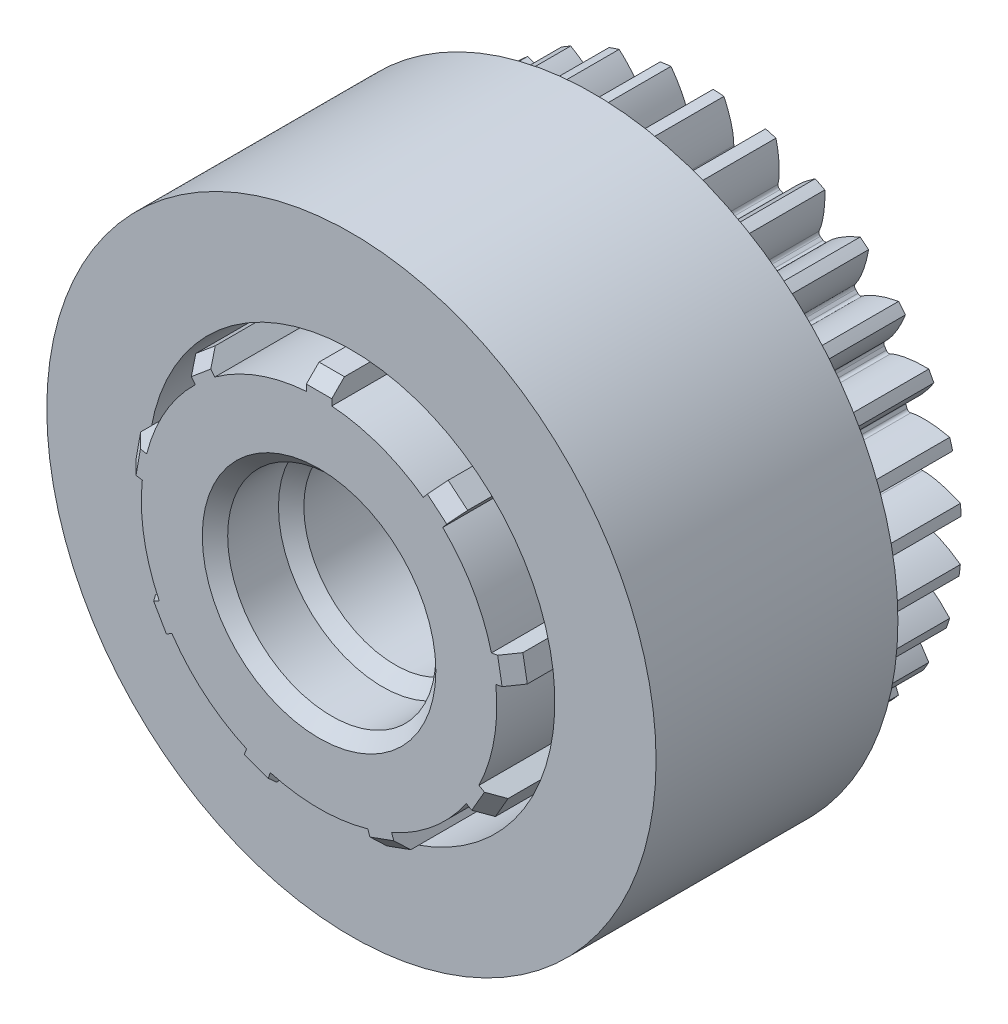
from build123d import *

# Parameters (mm, degrees)
SKETCH2_R                = 20.625
BOSS_EXTRUDE1_DEPTH      = 8
CUT_EXTRUDE1_DEPTH       = 8
FILLET1_R                = 0.254
CIRPATTERN3_COUNT        = 31
FILLET1_OF_CIRPATTERN3_R = 0.254
SKETCH3_R                = 14
BOSS_EXTRUDE2_DEPTH      = 22
SKETCH5_R                = 20.625
SKETCH5_R_2              = 8.2
BOSS_EXTRUDE3_DEPTH      = 0.4
CHAMFER1_SIZE            = 1
SKETCH6_R                = 24
SKETCH6_R_2              = 16.024540552
BOSS_EXTRUDE4_DEPTH      = 19.05


# Read off the part's stored shape, not the designer's step: Cut-Extrude1
with BuildPart() as part:
    # Sketch2 → Boss-Extrude1 (new body)
    with BuildSketch(Plane.XY):
        Circle(SKETCH2_R)
    extrude(amount=BOSS_EXTRUDE1_DEPTH)

    # Cut-Extrude1 outline → Cut-Extrude1 (cut)
    with BuildSketch(Plane.XY):
        with BuildLine():
            add(Edge.make_bspline(
                [(17.559713374, 0), (17.572698233, 0), (17.609107204, 0.000850571), (17.677859211, 0.005816678), (17.78968329, 0.018678066), (17.931450237, 0.042034495), (18.113517418, 0.080180555), (18.32617441, 0.13528476), (18.557559261, 0.206406213), (18.806378806, 0.295060405), (19.051715478, 0.393383127), (19.293462298, 0.500544622), (19.531396185, 0.615418835), (19.815898477, 0.764023045), (20.110883358, 0.932046436), (20.343724673, 1.076798935), (20.517173394, 1.190900484), (20.587786759, 1.238410823)],
                knots=[0, 0, 0, 0, 0, 0.005376748, 0.015083688, 0.02853182, 0.046610139, 0.064854849, 0.092110525, 0.119476175, 0.146842495, 0.174208853, 0.201574955, 0.228941013, 0.256307345, 0.307035032, 0.342302919, 0.342302919, 0.342302919, 0.342302919, 0.342302919], degree=4))
            Line((17.559713374, 0), (17.544673734, -0.726606726))
            add(Edge.make_bspline(
                [(20.518909181, -2.089256094), (20.450322235, -2.038864523), (20.281743499, -1.917683532), (20.055091351, -1.763420227), (19.767311792, -1.58333451), (19.489202294, -1.423085103), (19.256225596, -1.298463766), (19.019120084, -1.181390766), (18.778062055, -1.073000423), (18.533124059, -0.974126211), (18.304880333, -0.893491155), (18.094685647, -0.829634571), (17.914352856, -0.78398739), (17.773673801, -0.754784764), (17.662477692, -0.737307201), (17.593990063, -0.729500446), (17.557647471, -0.727144029), (17.544673734, -0.726606726)],
                knots=[0.566787997, 0.566787997, 0.566787997, 0.566787997, 0.566787997, 0.602055884, 0.652783571, 0.680149903, 0.707515961, 0.734882063, 0.762248421, 0.789614741, 0.816980391, 0.844236067, 0.862480777, 0.880559096, 0.894007228, 0.903714168, 0.909090916, 0.909090916, 0.909090916, 0.909090916, 0.909090916], degree=4))
            ThreePointArc((20.518909181, -2.089256094), (20.620583274, -0.426814303), (20.587786759, 1.238410823))
        make_face()
    cut_extrude1 = extrude(amount=CUT_EXTRUDE1_DEPTH, mode=Mode.SUBTRACT)

    # Fillet1
    fillet1_edges = [part.edges().sort_by_distance(p)[0] for p in [
        (17.544673734, -0.726606726, 4),
        (17.559713374, 0, 4),
    ]]
    fillet(fillet1_edges, radius=FILLET1_R)

    # CirPattern3: Cut-Extrude1 ×31 about axis
    cirpattern3_axis = Axis((0, 0, 18.908609159), (0, 0, -1))
    for i in range(1, CIRPATTERN3_COUNT):
        add(cut_extrude1.rotate(cirpattern3_axis, i * 360 / CIRPATTERN3_COUNT), mode=Mode.SUBTRACT)

    # Fillet1 of CirPattern3
    fillet1_of_cirpattern3_edges = [part.edges().sort_by_distance(p)[0] for p in [
        (17.039268373, -4.243449902, 4),
        (17.20026501, -3.534744315, 4),
        (15.836273363, -7.58656574, 4),
        (16.136635775, -6.924775783, 4),
        (13.984939461, -10.619086685, 4),
        (14.412370775, -10.031306117, 4),
        (11.561060495, -13.216860974, 4),
        (12.098061623, -12.727153599, 4),
        (8.663870353, -15.273535422, 4),
        (9.288456407, -14.901949918, 4),
        (5.411980341, -16.704909535, 4),
        (6.098580693, -16.466658656, 4),
        (1.938523218, -17.452382688, 4),
        (2.65902837, -17.357220454, 4),
        (-1.614297274, -17.485353244, 4),
        (-0.889384887, -17.537175608, 4),
        (-5.101028245, -16.802471384, 4),
        (-4.401386623, -16.999156731, 4),
        (-8.378922521, -15.431694371, 4),
        (-7.733195073, -15.765190381, 4),
        (-11.313782724, -13.429141977, 4),
        (-10.748405608, -13.885795284, 4),
        (-13.785455333, -10.876798933, 4),
        (-13.323575155, -11.437914096, 4),
        (-15.692749781, -7.879158463, 4),
        (-15.353275969, -8.521763362, 4),
        (-16.957581209, -4.558944319, 4),
        (-16.754411861, -5.256730634, 4),
        (-17.52816727, -1.05208646, 4),
        (-17.469620163, -1.776486737, 4),
        (-17.381148104, 2.497843943, 4),
        (-17.469620163, 1.776486737, 4),
        (-16.522542692, 5.945512322, 4),
        (-16.754411861, 5.256730634, 4),
        (-14.987502441, 9.149770727, 4),
        (-15.353275969, 8.521763362, 4),
        (-12.838872079, 11.979436444, 4),
        (-13.323575155, 11.437914096, 4),
        (-10.164616785, 14.318662625, 4),
        (-10.748405608, 13.885795284, 4),
        (-7.074220886, 16.071681076, 4),
        (-7.733195073, 15.765190381, 4),
        (-3.694205553, 17.166723016, 4),
        (-4.401386623, 16.999156731, 4),
        (-0.162949011, 17.558957298, 4),
        (-0.889384887, 17.537175608, 4),
        (3.374978683, 17.232325805, 4),
        (2.65902837, 17.357220454, 4),
        (6.774734354, 16.200200869, 4),
        (6.098580693, 16.466658656, 4),
        (9.897131604, 14.504837806, 4),
        (9.288456407, 14.901949918, 4),
        (12.614339123, 12.215644979, 4),
        (12.098061623, 12.727153599, 4),
        (14.815114116, 9.426342212, 4),
        (14.412370775, 10.031306117, 4),
        (16.409356597, 6.251123886, 4),
        (16.136635775, 6.924775783, 4),
        (17.331798091, 2.819983814, 4),
        (17.20026501, 3.534744315, 4),
    ]]
    fillet(fillet1_of_cirpattern3_edges, radius=FILLET1_OF_CIRPATTERN3_R)

    # Sketch3 → Boss-Extrude2 (add)
    with BuildSketch(Plane.XY.offset(8)):
        Circle(SKETCH3_R)
        with BuildLine():
            ThreePointArc((-13.925740038, 1.440057083), (-13.787308542, 2.431074487), (-13.578443682, 3.409672589))
            Line((-13.578443682, 3.409672589), (-15.055655312, 3.670144856))
            Line((-15.055655312, 3.670144856), (-15.402951667, 1.70052935))
            Line((-15.402951667, 1.70052935), (-13.925740038, 1.440057083))
        make_face()
        with BuildLine():
            ThreePointArc((-9.742084922, 10.054440878), (-8.999026536, 10.724622204), (-8.209996036, 11.340016098))
            Line((-8.209996036, 11.340016098), (-9.17417745, 12.489082762))
            Line((-9.17417745, 12.489082762), (-10.706266336, 11.203507543))
            Line((-10.706266336, 11.203507543), (-9.742084922, 10.054440878))
        make_face()
        with BuildLine():
            ThreePointArc((-1, 13.964240044), (0, 14), (1, 13.964240044))
            Line((1, 13.964240044), (1, 15.464240044))
            Line((1, 15.464240044), (-1, 15.464240044))
            Line((-1, 15.464240044), (-1, 13.964240044))
        make_face()
        with BuildLine():
            Line((9.17417745, 12.489082762), (8.209996036, 11.340016098))
            ThreePointArc((8.209996036, 11.340016098), (8.999026536, 10.724622204), (9.742084922, 10.054440878))
            Line((9.742084922, 10.054440878), (10.706266336, 11.203507543))
            Line((10.706266336, 11.203507543), (9.17417745, 12.489082762))
        make_face()
        with BuildLine():
            Line((15.055655312, 3.670144856), (13.578443682, 3.409672589))
            ThreePointArc((13.578443682, 3.409672589), (13.787308542, 2.431074487), (13.925740038, 1.440057083))
            Line((13.925740038, 1.440057083), (15.402951667, 1.70052935))
            Line((15.402951667, 1.70052935), (15.055655312, 3.670144856))
        make_face()
        with BuildLine():
            Line((13.892424728, -6.866094618), (12.593386622, -6.116094618))
            ThreePointArc((12.593386622, -6.116094618), (12.124355653, -7), (11.593386622, -7.848145426))
            Line((11.593386622, -7.848145426), (12.892424728, -8.598145426))
            Line((12.892424728, -8.598145426), (13.892424728, -6.866094618))
        make_face()
        with BuildLine():
            Line((6.228774217, -14.189612112), (5.715744002, -12.780073181))
            ThreePointArc((5.715744002, -12.780073181), (4.788282007, -13.155696691), (3.83635876, -13.464113467))
            Line((3.83635876, -13.464113467), (4.349388975, -14.873652399))
            Line((4.349388975, -14.873652399), (6.228774217, -14.189612112))
        make_face()
        with BuildLine():
            ThreePointArc((-3.83635876, -13.464113467), (-4.788282007, -13.155696691), (-5.715744002, -12.780073181))
            Line((-5.715744002, -12.780073181), (-6.228774217, -14.189612112))
            Line((-6.228774217, -14.189612112), (-4.349388975, -14.873652399))
            Line((-4.349388975, -14.873652399), (-3.83635876, -13.464113467))
        make_face()
        with BuildLine():
            ThreePointArc((-11.593386622, -7.848145426), (-12.124355653, -7), (-12.593386622, -6.116094618))
            Line((-12.593386622, -6.116094618), (-13.892424728, -6.866094618))
            Line((-13.892424728, -6.866094618), (-12.892424728, -8.598145426))
            Line((-12.892424728, -8.598145426), (-11.593386622, -7.848145426))
        make_face()
    extrude(amount=BOSS_EXTRUDE2_DEPTH)

    # Sketch4 → Cut-Revolve1 (revolve, cut)
    with BuildSketch(Plane(origin=(0, 0, 0), x_dir=(0, 0, -1), z_dir=(1, 0, 0)), mode=Mode.PRIVATE) as cut_revolve1_sk:
        Polygon((-30, 8.2), (-25, 8.2), (-24, 7.2), (-6, 7.2), (-5, 8.2), (0, 8.2), (0, 0), (-30, 0), align=None)
    revolve(cut_revolve1_sk.sketch.rotate(Axis((0, 0, 0), (0, 0, 1)), 90), axis=Axis((0, 0, 0), (0, 0, 1)), mode=Mode.SUBTRACT)

    # Sketch5 → Boss-Extrude3 (add)
    with BuildSketch(Plane.XY.offset(8)):
        with Locations(Location((0, 0, 0), (0, 0, 179.992573951))):
            Circle(SKETCH5_R)
        with Locations(Location((0, 0, 0), (0, 0, 180))):
            Circle(SKETCH5_R_2, mode=Mode.SUBTRACT)
    extrude(amount=BOSS_EXTRUDE3_DEPTH)

    # Chamfer1
    chamfer1_edges = [part.edges().sort_by_distance(p)[0] for p in [
        (15.22930349, 2.685337103, 30),
        (9.940221893, 11.846295153, 30),
        (0, 15.464240044, 30),
        (-9.940221893, 11.846295153, 30),
        (-15.22930349, 2.685337103, 30),
        (-13.392424728, -7.732120022, 30),
        (-5.289081596, -14.531632255, 30),
        (5.289081596, -14.531632255, 30),
        (13.392424728, -7.732120022, 30),
        (8.2, 0, 30),
        (8.2, 0, 0),
    ]]
    chamfer(chamfer1_edges, length=CHAMFER1_SIZE)


with BuildPart() as body_2:
    # Sketch6 → Boss-Extrude4 (new body)
    with BuildSketch(Plane.XY.offset(8.4)):
        with Locations(Location((0, 0, 0), (0, 0, 180))):
            Circle(SKETCH6_R)
        with Locations(Location((0, 0, 0), (0, 0, 180))):
            Circle(SKETCH6_R_2, mode=Mode.SUBTRACT)
    extrude(amount=BOSS_EXTRUDE4_DEPTH)


solid = Compound([part.part, body_2.part])
